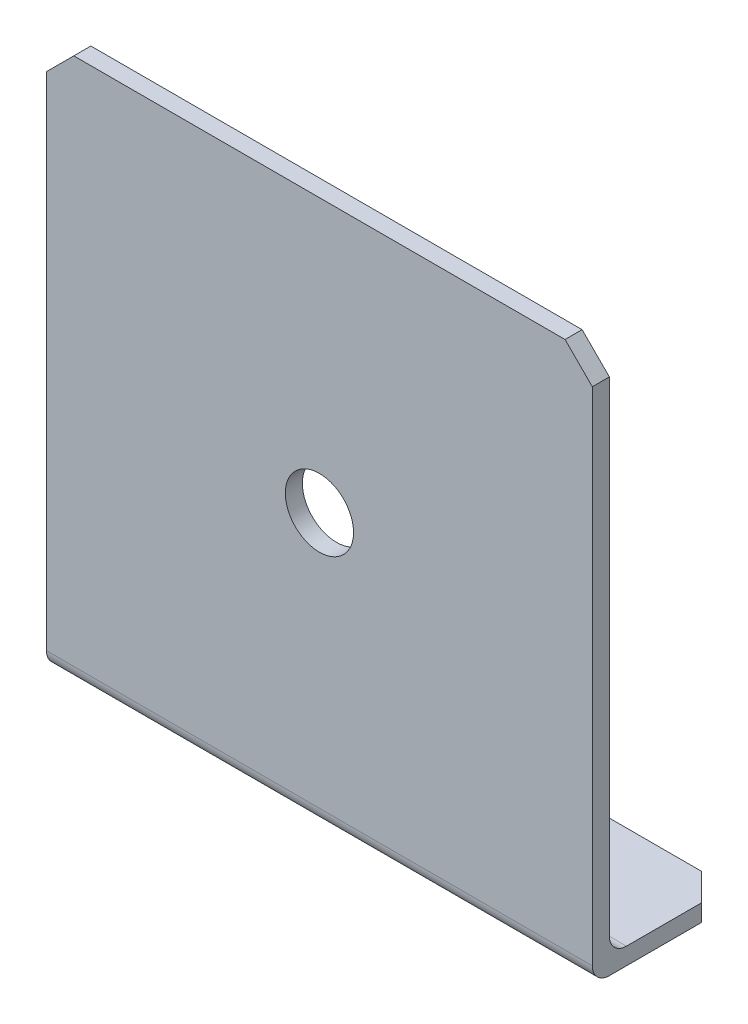
from build123d import *

# Parameters (mm, degrees)
BOSS_EXTRUDE1_DEPTH = 50.8
SKETCH2_R           = 2.54
CUT_EXTRUDE1_DEPTH  = 73.955945611
SKETCH3_R           = 3.175
CUT_EXTRUDE2_DEPTH  = 73.955945611
CHAMFER1_SIZE       = 2.54


with BuildPart() as part:
    # Sketch1 → Boss-Extrude1 (new body)
    with BuildSketch(Plane(origin=(0, 0, 0), x_dir=(0, 0, -1), z_dir=(1, 0, 0))):
        with BuildLine():
            Line((0, 1.5875), (0, 50.8))
            Line((0, 50.8), (1.5875, 50.8))
            Line((1.5875, 50.8), (1.5875, 3.175))
            ThreePointArc((1.5875, 3.175), (2.052467985, 2.052467985), (3.175, 1.5875))
            Line((3.175, 1.5875), (12.7, 1.5875))
            Line((12.7, 1.5875), (12.7, 0))
            Line((12.7, 0), (1.5875, 0))
            ThreePointArc((1.5875, 0), (0.464967985, 0.464967985), (0, 1.5875))
        make_face()
    extrude(amount=BOSS_EXTRUDE1_DEPTH)

    # Sketch2 → Cut-Extrude1 (cut, through all)
    with BuildSketch(Plane.XZ):
        with Locations((38.1, -6.35)):
            Circle(SKETCH2_R)
        with Locations((12.7, -6.35)):
            Circle(SKETCH2_R)
    extrude(amount=-CUT_EXTRUDE1_DEPTH, mode=Mode.SUBTRACT)

    # Sketch3 → Cut-Extrude2 (cut, through all)
    with BuildSketch(Plane.XY):
        with Locations((25.4, 25.4)):
            Circle(SKETCH3_R)
    extrude(amount=-CUT_EXTRUDE2_DEPTH, mode=Mode.SUBTRACT)

    # Chamfer1
    chamfer1_edges = [part.edges().sort_by_distance(p)[0] for p in [
        (0, 0.79375, -12.7),
        (0, 50.8, -0.79375),
        (50.8, 50.8, -0.79375),
        (50.8, 0.79375, -12.7),
    ]]
    chamfer(chamfer1_edges, length=CHAMFER1_SIZE)


solid = part.part
